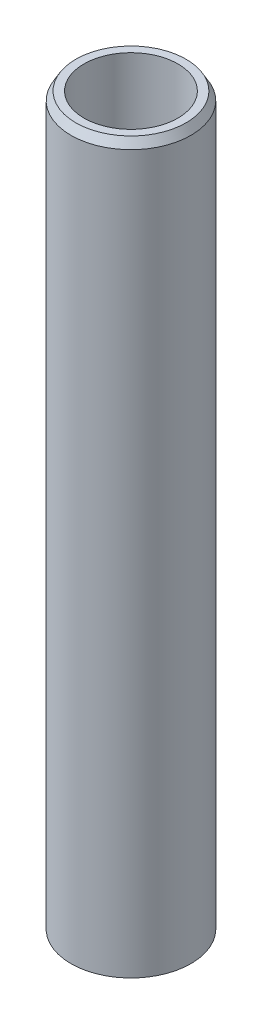
from build123d import *
from OCP.BRepFilletAPI import BRepFilletAPI_MakeChamfer

# Parameters (mm, degrees)
SKETCH1_R           = 25
BOSS_EXTRUDE1_DEPTH = 304.508595336
SKETCH2_R           = 19.583746745
CUT_EXTRUDE1_DEPTH  = 307.554211574
CHAMFER1_SIZE       = 3.509875589
CHAMFER1_SIZE2      = 2.026427616


with BuildPart() as part:
    # Sketch1 → Boss-Extrude1 (new body)
    with BuildSketch(Plane(origin=(0, 0, 0), x_dir=(1, 0, 0), z_dir=(0, 1, 0))):
        Circle(SKETCH1_R)
    extrude(amount=BOSS_EXTRUDE1_DEPTH)

    # Sketch2 → Cut-Extrude1 (cut, through all)
    with BuildSketch(Plane(origin=(0, 0, 0), x_dir=(1, 0, 0), z_dir=(0, 1, 0))):
        Circle(SKETCH2_R)
    extrude(amount=CUT_EXTRUDE1_DEPTH, mode=Mode.SUBTRACT)

    # Chamfer1: one chamfer whose edges measure the first distance from different faces: ONE call of the kernel's chamfer builder (chamfer() names one face for all edges)
    chamfer1_edges_1 = [part.edges().sort_by_distance(p)[0] for p in [
        (-25, 304.508595336, 0),
    ]]
    chamfer1_side_1 = [part.faces().sort_by_distance(p)[0] for p in [
        (-25, 152.254297668, 0),
    ]]
    chamfer1_edges_2 = [part.edges().sort_by_distance(p)[0] for p in [
        (-25, 0, 0),
    ]]
    chamfer1_side_2 = [part.faces().sort_by_distance(p)[0] for p in [
        (-24.292893219, 0, 0),
    ]]
    chamfer1 = BRepFilletAPI_MakeChamfer(part.part.solid().wrapped)
    for e in chamfer1_edges_1:
        chamfer1.Add(CHAMFER1_SIZE, CHAMFER1_SIZE2, e.wrapped, chamfer1_side_1[0].wrapped)  # the first distance lies on this face
    for e in chamfer1_edges_2:
        chamfer1.Add(CHAMFER1_SIZE, CHAMFER1_SIZE2, e.wrapped, chamfer1_side_2[0].wrapped)  # the first distance lies on this face
    add(Compound.cast(chamfer1.Shape()), mode=Mode.REPLACE)


solid = part.part
